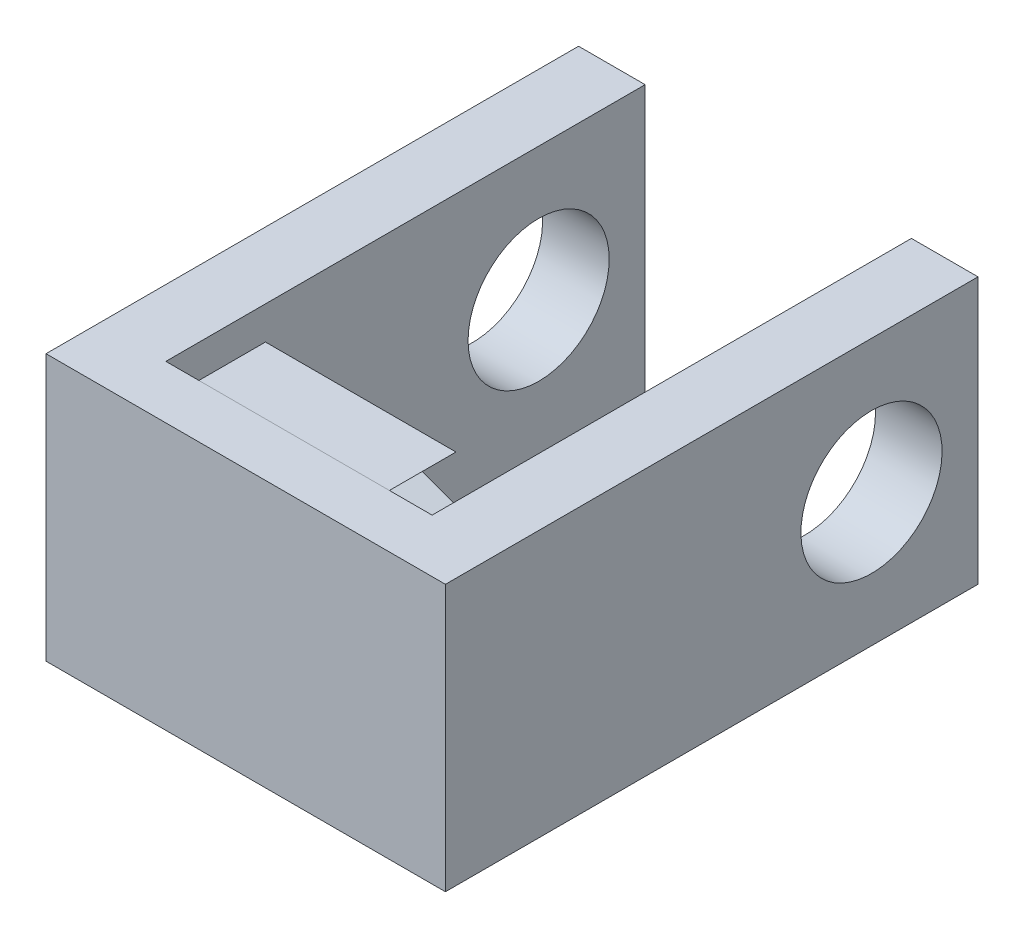
from build123d import *

# Parameters (mm, degrees)
SKETCH1_W           = 15
SKETCH1_H           = 10
BOSS_EXTRUDE1_DEPTH = 2
SKETCH2_W           = 2.5
SKETCH2_H           = 10
BOSS_EXTRUDE2_DEPTH = 18
SKETCH3_R           = 2.65
CUT_EXTRUDE1_DEPTH  = 26.475478406
BOSS_EXTRUDE3_DEPTH = 2.5


with BuildPart() as part:
    # Sketch1 → Boss-Extrude1 (new body)
    with BuildSketch(Plane.XY):
        with Locations((7.5, 5)):
            Rectangle(SKETCH1_W, SKETCH1_H)
    extrude(amount=BOSS_EXTRUDE1_DEPTH)

    # Sketch2 → Boss-Extrude2 (add)
    with BuildSketch(Plane(origin=(0, 0, 0), x_dir=(-1, 0, 0), z_dir=(0, 0, -1))):
        with Locations((-13.75, 5)):
            Rectangle(SKETCH2_W, SKETCH2_H)
        with Locations((-1.25, 5)):
            Rectangle(SKETCH2_W, SKETCH2_H)
    extrude(amount=BOSS_EXTRUDE2_DEPTH)

    # Sketch3 → Cut-Extrude1 (cut, through all)
    with BuildSketch(Plane(origin=(15, 0, 0), x_dir=(0, 0, -1), z_dir=(1, 0, 0))):
        with Locations((14, 5)):
            Circle(SKETCH3_R)
    extrude(amount=-CUT_EXTRUDE1_DEPTH, mode=Mode.SUBTRACT)


with BuildPart() as body_2:
    # Sketch4 → Boss-Extrude3 (new body)
    with BuildSketch(Plane(origin=(0, 0, 0), x_dir=(-1, 0, 0), z_dir=(0, 0, -1))):
        with BuildLine():
            Line((-3.741644851, 0), (-3.741644851, 10))
            Line((-3.741644851, 10), (-10.89578677, 10))
            Line((-10.89578677, 10), (-9.391753796, 9.452576766))
            ThreePointArc((-9.391753796, 9.452576766), (-9.311908661, 9.39130944), (-9.281644851, 9.295324896))
            Line((-9.281644851, 9.295324896), (-9.281644851, 8.971862729))
            ThreePointArc((-9.281644851, 8.971862729), (-9.311908661, 8.875878186), (-9.391753796, 8.814610859))
            Line((-9.391753796, 8.814610859), (-11.041644851, 8.214099625))
            Line((-11.041644851, 8.214099625), (-11.041644851, 7.539816))
            Line((-11.041644851, 7.539816), (-9.391753796, 6.939304766))
            ThreePointArc((-9.391753796, 6.939304766), (-9.311908661, 6.87803744), (-9.281644851, 6.782052896))
            Line((-9.281644851, 6.782052896), (-9.281644851, 6.458590729))
            ThreePointArc((-9.281644851, 6.458590729), (-9.311908661, 6.362606186), (-9.391753796, 6.301338859))
            Line((-9.391753796, 6.301338859), (-11.041644851, 5.700827625))
            Line((-11.041644851, 5.700827625), (-11.041644851, 5.026544))
            Line((-11.041644851, 5.026544), (-9.391753796, 4.426032766))
            ThreePointArc((-9.391753796, 4.426032766), (-9.311908661, 4.36476544), (-9.281644851, 4.268780896))
            Line((-9.281644851, 4.268780896), (-9.281644851, 3.945318729))
            ThreePointArc((-9.281644851, 3.945318729), (-9.311908661, 3.849334186), (-9.391753796, 3.788066859))
            Line((-9.391753796, 3.788066859), (-11.041644851, 3.187555625))
            Line((-11.041644851, 3.187555625), (-11.041644851, 2.513272))
            Line((-11.041644851, 2.513272), (-9.391753796, 1.912760766))
            ThreePointArc((-9.391753796, 1.912760766), (-9.311908661, 1.85149344), (-9.281644851, 1.755508896))
            Line((-9.281644851, 1.755508896), (-9.281644851, 1.432046729))
            ThreePointArc((-9.281644851, 1.432046729), (-9.311908661, 1.336062186), (-9.391753796, 1.274794859))
            Line((-9.391753796, 1.274794859), (-11.041644851, 0.674283625))
            Line((-11.041644851, 0.674283625), (-11.041644851, 0))
            Line((-11.041644851, 0), (-3.741644851, 0))
        make_face()
    extrude(amount=BOSS_EXTRUDE3_DEPTH)


solid = Compound([part.part, body_2.part])
